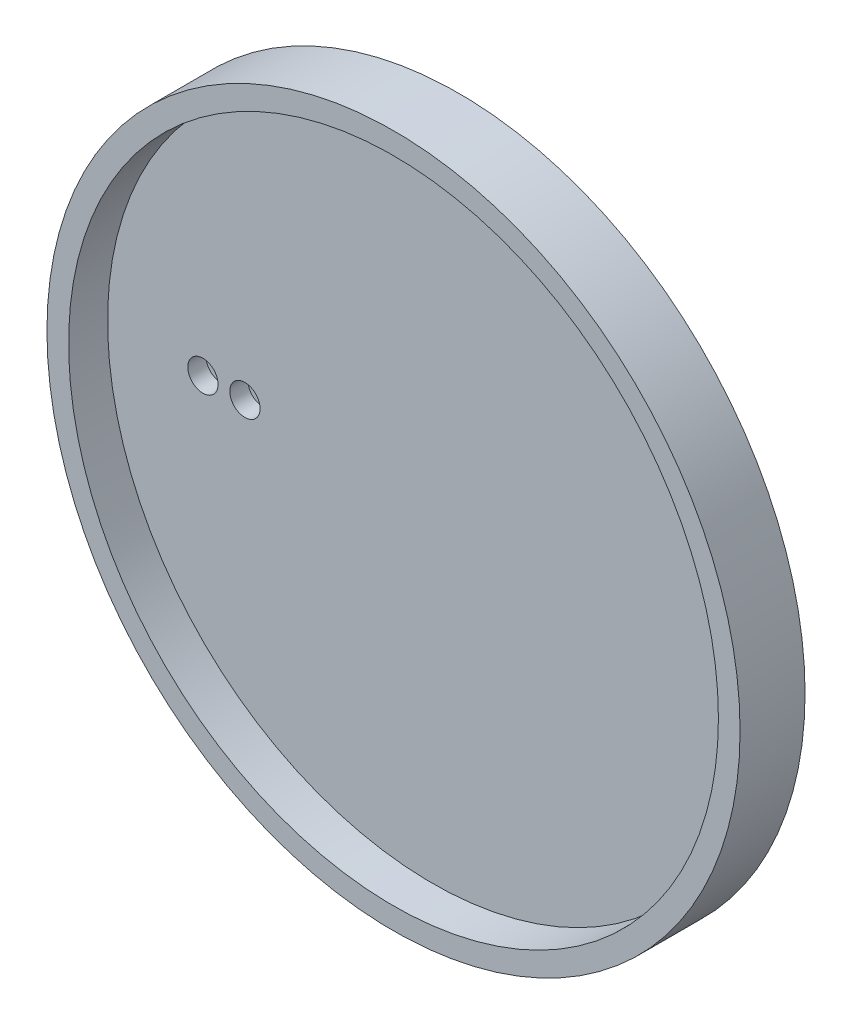
from build123d import *
from build123d.topology import SkipClean

# Parameters (mm, degrees)
BOSS_EXTRUDE1_DEPTH = 12.7
SKETCH2_R           = 2.05
CUT_EXTRUDE1_DEPTH  = 12.7
SKETCH3_R           = 75
SKETCH3_R_2         = 2.05
BOSS_EXTRUDE2_DEPTH = 6
SKETCH3_4_R         = 80
SKETCH3_4_R_2       = 75
BOSS_EXTRUDE3_DEPTH = 15
SKETCH4_R           = 3.5
CUT_EXTRUDE2_DEPTH  = 4.2


with BuildPart() as part:
    # Sketch1 → Boss-Extrude1 (new body)
    with BuildSketch(Plane(origin=(0, 0, 0), x_dir=(1, 0, 0), z_dir=(0, 1, 0))):
        Polygon((-58.57612782, 0), (16.42387218, 0), (16.42387218, 5), (-37.711466165, 5), (-37.711466165, 10), (-58.57612782, 10), align=None)
    extrude(amount=BOSS_EXTRUDE1_DEPTH)

    # Sketch2 → Cut-Extrude1 (cut)
    with BuildSketch(Plane(origin=(0, 0, -10), x_dir=(-1, 0, 0), z_dir=(0, 0, -1))):
        with Locations((43.293796992, 6.35)):
            Circle(SKETCH2_R)
        with Locations((52.993796992, 6.35)):
            Circle(SKETCH2_R)
    extrude(amount=-CUT_EXTRUDE1_DEPTH, mode=Mode.SUBTRACT)

    # Sketch3 → Boss-Extrude2 (add)
    with SkipClean():  # the faces are left unmerged after this step: merging them gives an invalid solid
        with BuildSketch(Plane.XY):
            with Locations((0, 6.35)):
                Circle(SKETCH3_R)
            with Locations((-52.993796992, 6.35)):
                Circle(SKETCH3_R_2, mode=Mode.SUBTRACT)
            with Locations((-43.293796992, 6.35)):
                Circle(SKETCH3_R_2, mode=Mode.SUBTRACT)
        extrude(amount=BOSS_EXTRUDE2_DEPTH)

    # Sketch3<4> → Boss-Extrude3 (add)
    with SkipClean():  # the faces are left unmerged after this step: merging them gives an invalid solid
        with BuildSketch(Plane.XY):
            with Locations((0, 6.35)):
                Circle(SKETCH3_4_R)
            with Locations((0, 6.35)):
                Circle(SKETCH3_4_R_2, mode=Mode.SUBTRACT)
        extrude(amount=BOSS_EXTRUDE3_DEPTH)

    # Sketch4 → Cut-Extrude2 (cut)
    with SkipClean():  # the faces are left unmerged after this step: merging them gives an invalid solid
        with BuildSketch(Plane.XY.offset(6)):
            with Locations((-52.993796992, 6.35)):
                Circle(SKETCH4_R)
            with Locations((-43.293796992, 6.35)):
                Circle(SKETCH4_R)
        extrude(amount=-CUT_EXTRUDE2_DEPTH, mode=Mode.SUBTRACT)


solid = part.part
